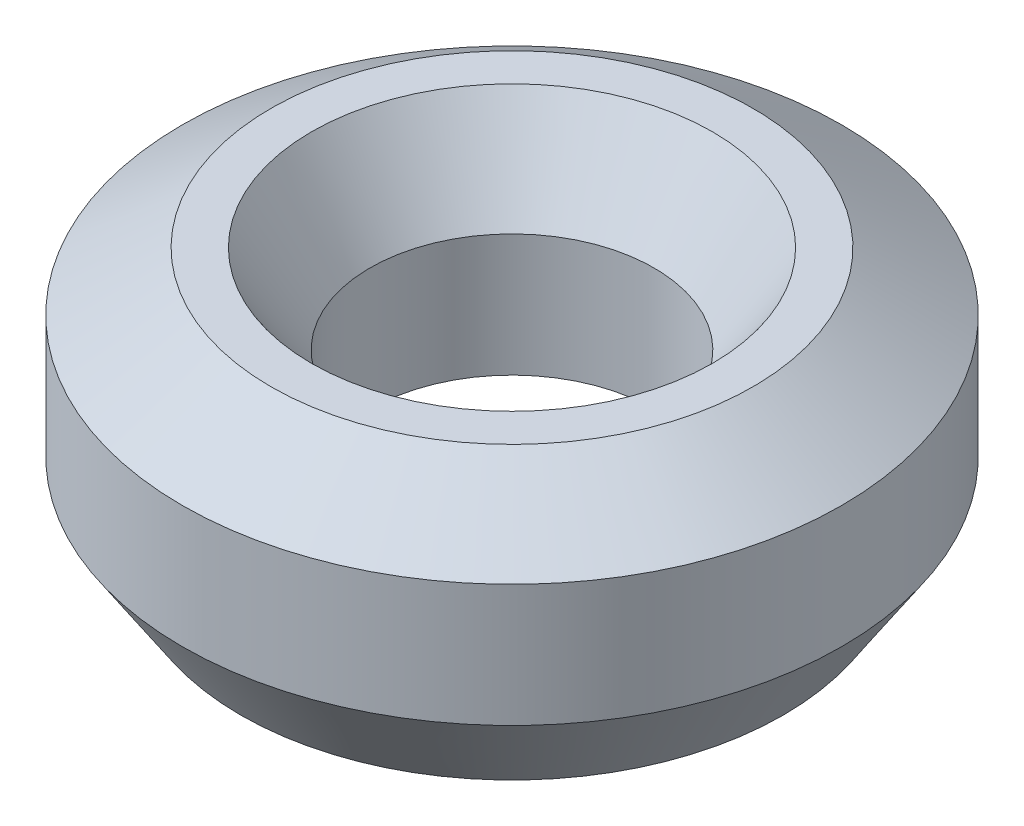
from build123d import *
from OCP.BRepFilletAPI import BRepFilletAPI_MakeChamfer

# Parameters (mm, degrees)
SKETCH1_R           = 22.5
BOSS_EXTRUDE1_DEPTH = 18.385052771
SKETCH2_R           = 9.693357675
CUT_EXTRUDE1_DEPTH  = 37.749287957
CHAMFER1_SIZE       = 3.992950919
CHAMFER1_SIZE2      = 6.0470408


with BuildPart() as part:
    # Sketch1 → Boss-Extrude1 (new body)
    with BuildSketch(Plane(origin=(0, 0, 0), x_dir=(1, 0, 0), z_dir=(0, 1, 0))):
        Circle(SKETCH1_R)
    extrude(amount=BOSS_EXTRUDE1_DEPTH)

    # Sketch2 → Cut-Extrude1 (cut, through all)
    with BuildSketch(Plane(origin=(0, 0, 0), x_dir=(1, 0, 0), z_dir=(0, 1, 0))):
        Circle(SKETCH2_R)
    extrude(amount=CUT_EXTRUDE1_DEPTH, mode=Mode.SUBTRACT)

    # Chamfer1: one chamfer whose edges measure the first distance from different faces: ONE call of the kernel's chamfer builder (chamfer() names one face for all edges)
    chamfer1_edges_1 = [part.edges().sort_by_distance(p)[0] for p in [
        (-9.693357675, 18.385052771, 0),
    ]]
    chamfer1_side_1 = [part.faces().sort_by_distance(p)[0] for p in [
        (-21.863603897, 18.385052771, 0),
    ]]
    chamfer1_edges_2 = [part.edges().sort_by_distance(p)[0] for p in [
        (-9.693357675, 0, 0),
    ]]
    chamfer1_side_2 = [part.faces().sort_by_distance(p)[0] for p in [
        (-9.693357675, 9.192526385, 0),
    ]]
    chamfer1_edges_3 = [part.edges().sort_by_distance(p)[0] for p in [
        (-22.5, 0, 0),
    ]]
    chamfer1_side_3 = [part.faces().sort_by_distance(p)[0] for p in [
        (-21.863603897, 0, 0),
    ]]
    chamfer1_edges_4 = [part.edges().sort_by_distance(p)[0] for p in [
        (-22.5, 18.385052771, 0),
    ]]
    chamfer1_side_4 = [part.faces().sort_by_distance(p)[0] for p in [
        (-22.5, 9.192526385, 0),
    ]]
    chamfer1 = BRepFilletAPI_MakeChamfer(part.part.solid().wrapped)
    for e in chamfer1_edges_1:
        chamfer1.Add(CHAMFER1_SIZE, CHAMFER1_SIZE2, e.wrapped, chamfer1_side_1[0].wrapped)  # the first distance lies on this face
    for e in chamfer1_edges_2:
        chamfer1.Add(CHAMFER1_SIZE, CHAMFER1_SIZE2, e.wrapped, chamfer1_side_2[0].wrapped)  # the first distance lies on this face
    for e in chamfer1_edges_3:
        chamfer1.Add(CHAMFER1_SIZE, CHAMFER1_SIZE2, e.wrapped, chamfer1_side_3[0].wrapped)  # the first distance lies on this face
    for e in chamfer1_edges_4:
        chamfer1.Add(CHAMFER1_SIZE, CHAMFER1_SIZE2, e.wrapped, chamfer1_side_4[0].wrapped)  # the first distance lies on this face
    add(Compound.cast(chamfer1.Shape()), mode=Mode.REPLACE)


solid = part.part
